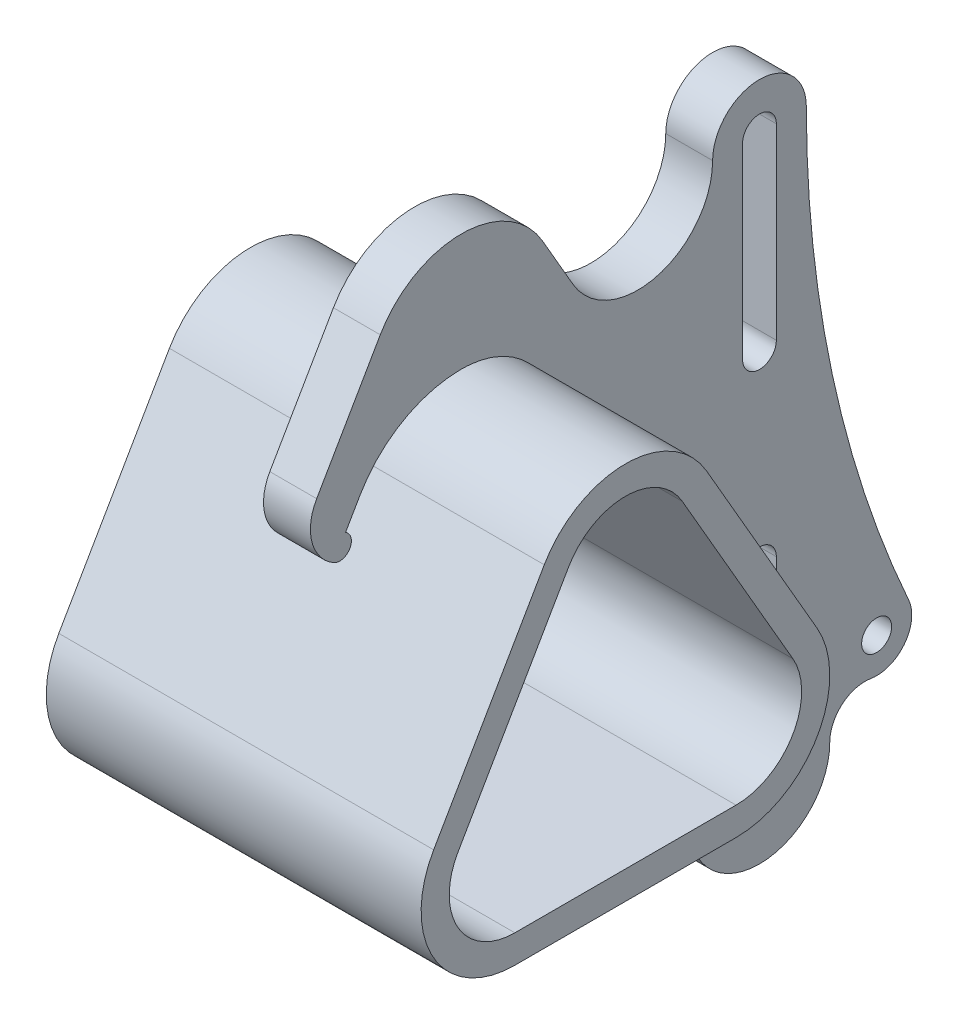
from build123d import *

# Parameters (mm, degrees)
BOSS_EXTRUDE1_DEPTH = 3.175
BOSS_EXTRUDE2_DEPTH = 25.4
SKETCH2_R           = 2.032
CUT_EXTRUDE1_DEPTH  = 113.304008925


with BuildPart() as part:
    # Sketch1 → Boss-Extrude1 (new, symmetric)
    with BuildSketch(Plane(origin=(0, 0, 0), x_dir=(0, 0, -1), z_dir=(1, 0, 0))):
        with BuildLine():
            Line((-9.525, 27.995558206), (-9.525, 0))
            ThreePointArc((-9.525, 0), (0, -9.525), (9.525, 0))
            ThreePointArc((9.525, 0), (11.213319469, 3.637419458), (15.08125, 4.695888328))
            ThreePointArc((15.08125, 4.695888328), (19.641895987, 6.477690029), (20.2209225, 11.339689352))
            ThreePointArc((20.2209225, 11.339689352), (9.856498573, 43.036532191), (6.35, 76.2))
            ThreePointArc((6.35, 76.2), (0, 82.55), (-6.35, 76.2))
            ThreePointArc((-6.35, 76.2), (-13.862736492, 66.409211184), (-25.264351554, 71.131914776))
            Line((-25.264351554, 71.131914776), (-29.38879754, 78.275664776))
            ThreePointArc((-29.38879754, 78.275664776), (-40.387320168, 84.625664776), (-51.385842796, 78.275664776))
            Line((-51.385842796, 78.275664776), (-60.003115424, 63.350110761))
            ThreePointArc((-60.003115424, 63.350110761), (-60.637483107, 58.531609825), (-57.67885411, 54.675849447))
            ThreePointArc((-57.67885411, 54.675849447), (-56.474228587, 54.517257604), (-55.510288483, 55.256915293))
            ThreePointArc((-55.510288483, 55.256915293), (-55.351696938, 56.461540298), (-56.09135411, 57.425480104))
            Line((-56.09135411, 57.425480104), (-54.135473453, 60.813164776))
            ThreePointArc((-54.135473453, 60.813164776), (-48.324820168, 66.623818061), (-40.387320168, 68.750664776))
            ThreePointArc((-40.387320168, 68.750664776), (-34.037320168, 67.049187404), (-29.38879754, 62.400664776))
            Line((-29.38879754, 62.400664776), (-14.401477372, 36.441864776))
            Line((-14.401477372, 36.441864776), (-9.525, 27.995558206))
        make_face()
    extrude(amount=BOSS_EXTRUDE1_DEPTH, both=True)

    # Sketch2 → Cut-Extrude1 (cut, through all)
    with BuildSketch(Plane(origin=(3.175, 0, 0), x_dir=(0, 0, -1), z_dir=(1, 0, 0))):
        with Locations((15.875, 9.391776656)):
            Circle(SKETCH2_R)
        with BuildLine():
            Line((-2.286, 0), (-2.286, 25.4))
            ThreePointArc((-2.286, 25.4), (0, 27.686), (2.286, 25.4))
            Line((2.286, 25.4), (2.286, 0))
            ThreePointArc((2.286, 0), (0, -2.286), (-2.286, 0))
        make_face()
        with BuildLine():
            Line((2.286, 76.2), (2.286, 50.8))
            ThreePointArc((2.286, 50.8), (0, 48.514), (-2.286, 50.8))
            Line((-2.286, 50.8), (-2.286, 76.2))
            ThreePointArc((-2.286, 76.2), (0, 78.486), (2.286, 76.2))
        make_face()
    extrude(amount=-CUT_EXTRUDE1_DEPTH, mode=Mode.SUBTRACT)


with BuildPart() as body_2:
    # Sketch1<3> → Boss-Extrude2 (new, symmetric)
    with BuildSketch(Plane(origin=(0, 0, 0), x_dir=(0, 0, -1), z_dir=(1, 0, 0))):
        with BuildLine():
            ThreePointArc((-25.4, 17.391864776), (-14.401477372, 23.741864776), (-14.401477372, 36.441864776))
            Line((-14.401477372, 36.441864776), (-29.38879754, 62.400664776))
            ThreePointArc((-29.38879754, 62.400664776), (-34.037320168, 67.049187404), (-40.387320168, 68.750664776))
            ThreePointArc((-40.387320168, 68.750664776), (-46.737320168, 67.049187404), (-51.385842796, 62.400664776))
            Line((-51.385842796, 62.400664776), (-55.510288483, 55.256915293))
            Line((-55.510288483, 55.256915293), (-66.373162964, 36.441864776))
            ThreePointArc((-66.373162964, 36.441864776), (-66.373162964, 23.741864776), (-55.374640336, 17.391864776))
            Line((-55.374640336, 17.391864776), (-25.4, 17.391864776))
        make_face()
        with BuildLine():
            Line((-25.4, 21.201864776), (-55.374640336, 21.201864776))
            ThreePointArc((-55.374640336, 21.201864776), (-63.073606175, 25.646864776), (-63.073606175, 34.536864776))
            Line((-63.073606175, 34.536864776), (-48.086286007, 60.495664776))
            ThreePointArc((-48.086286007, 60.495664776), (-40.387320168, 64.940664776), (-32.688354328, 60.495664776))
            Line((-32.688354328, 60.495664776), (-17.70103416, 34.536864776))
            ThreePointArc((-17.70103416, 34.536864776), (-17.70103416, 25.646864776), (-25.4, 21.201864776))
        make_face(mode=Mode.SUBTRACT)
    extrude(amount=BOSS_EXTRUDE2_DEPTH, both=True)


solid = Compound([part.part, body_2.part])
